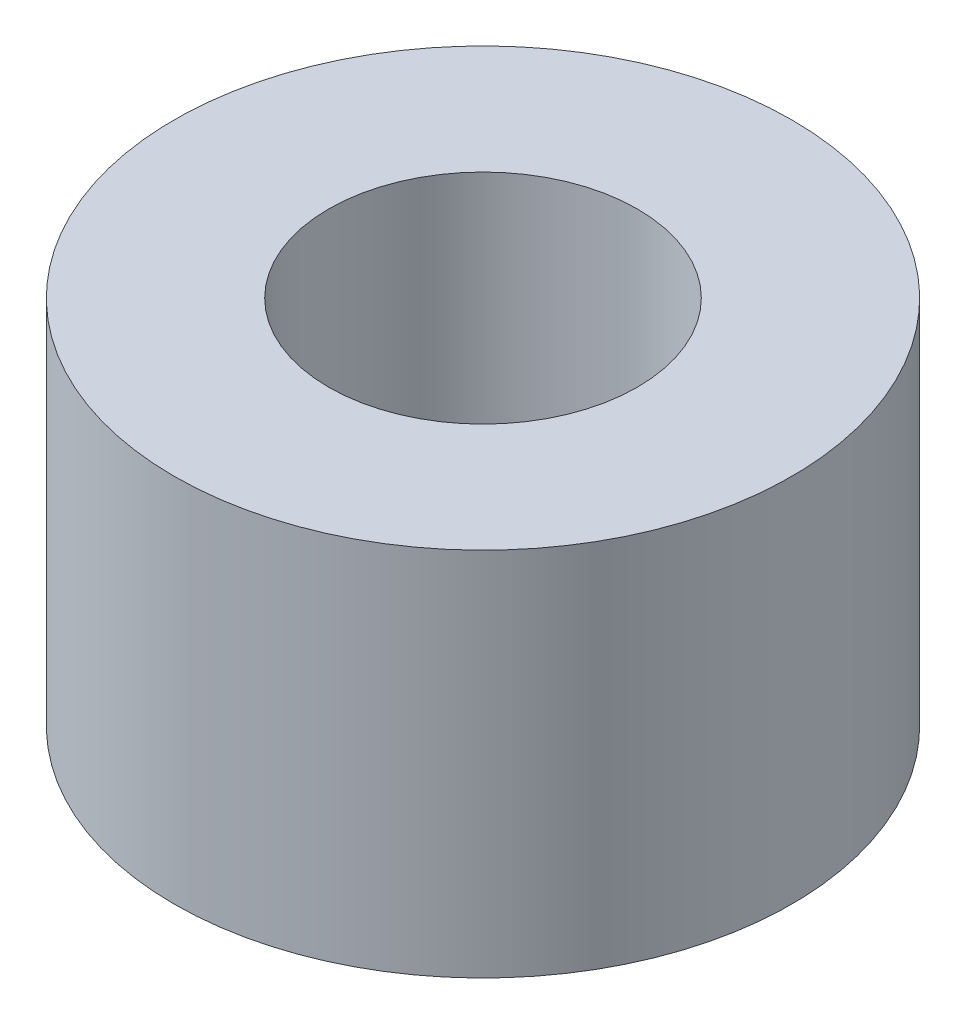
from build123d import *

# Parameters (mm, degrees)
SKETCH1_R           = 5
SKETCH1_R_2         = 2.5
BOSS_EXTRUDE1_DEPTH = 6


with BuildPart() as part:
    # Sketch1 → Boss-Extrude1 (new body)
    with BuildSketch(Plane(origin=(0, 0, 0), x_dir=(1, 0, 0), z_dir=(0, 1, 0))):
        Circle(SKETCH1_R)
        Circle(SKETCH1_R_2, mode=Mode.SUBTRACT)
    extrude(amount=BOSS_EXTRUDE1_DEPTH)


solid = part.part
